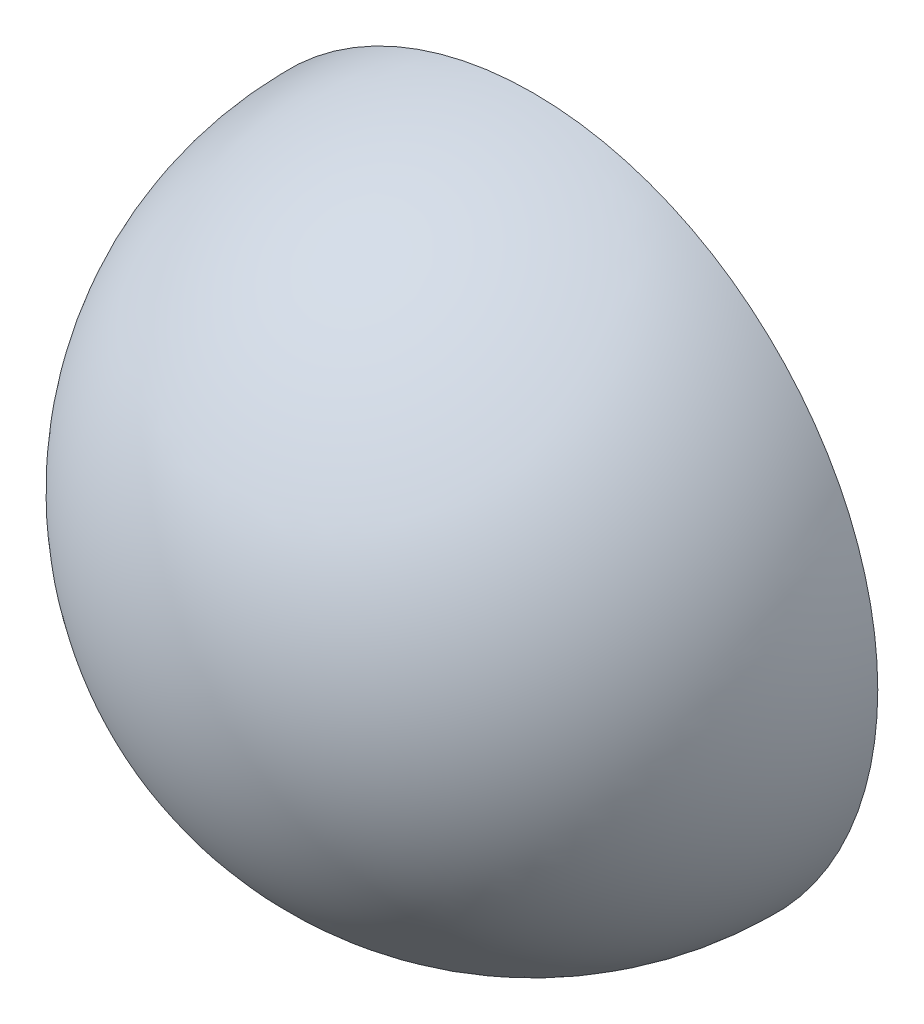
from build123d import *


with BuildPart() as part:
    # Sketch1 → Revolve4 (revolve)
    with BuildSketch(Plane(origin=(0, 0, 0), x_dir=(0, 0, -1), z_dir=(1, 0, 0))):
        with BuildLine():
            Line((0, 0), (0, 40))
            ThreePointArc((0, 40), (-28.284271247, 28.284271247), (-40, 0))
            Line((-40, 0), (0, 0))
        make_face()
    revolve(axis=Axis((0, 0, 89.313143957), (0, 0, -1)))


solid = part.part
